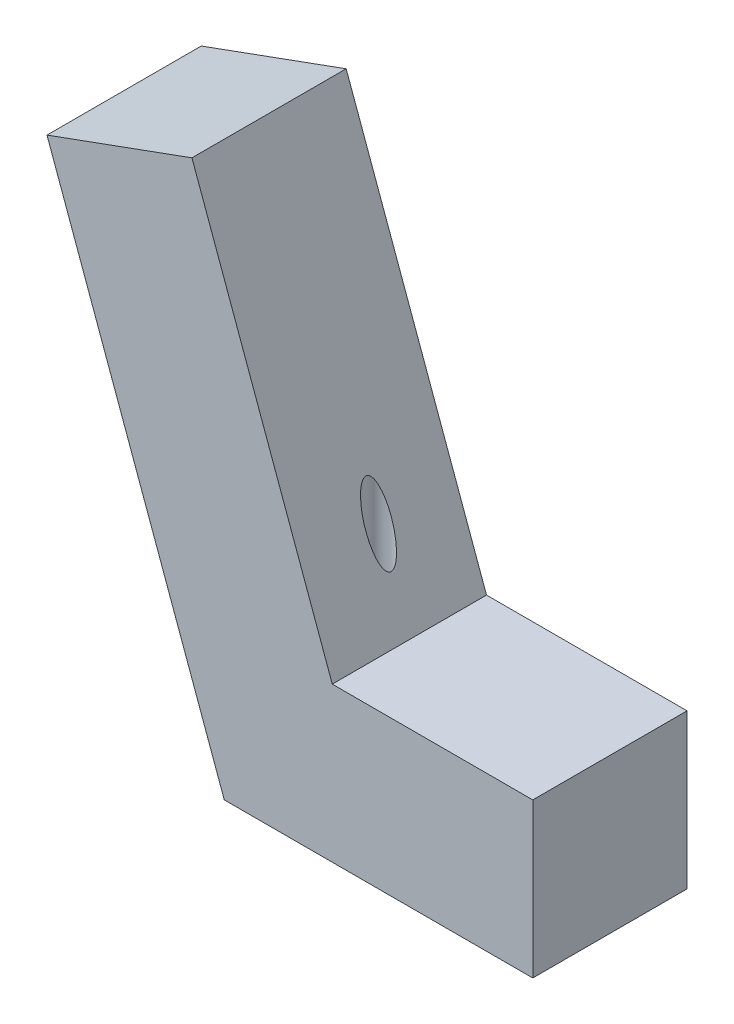
from build123d import *

# Parameters (mm, degrees)
BOSS_EXTRUDE1_DEPTH = 25.4
SKETCH3_R           = 6.35
CUT_EXTRUDE1_DEPTH  = 15.875
SKETCH4_R           = 2.0955
CUT_EXTRUDE2_DEPTH  = 98.893788925


with BuildPart() as part:
    # Sketch1 → Boss-Extrude1 (new body)
    with BuildSketch(Plane.XY):
        Polygon((0, 0), (-19.950187023, 54.81268836), (3.918005545, 63.5), (27.030115421, 0), (60.04484395, 0), (60.04484395, -25.4), (9.24484395, -25.4), align=None)
    extrude(amount=BOSS_EXTRUDE1_DEPTH)

    # Sketch3 → Cut-Extrude1 (cut)
    with BuildSketch(Plane.XZ.offset(25.4)):
        with Locations((21.94484395, 12.7)):
            Circle(SKETCH3_R)
    extrude(amount=-CUT_EXTRUDE1_DEPTH, mode=Mode.SUBTRACT)

    # Sketch4 → Cut-Extrude2 (cut, through all)
    with BuildSketch(Plane.XZ.offset(9.525)):
        with Locations((21.94484395, 12.7)):
            Circle(SKETCH4_R)
    extrude(amount=-CUT_EXTRUDE2_DEPTH, mode=Mode.SUBTRACT)


solid = part.part
